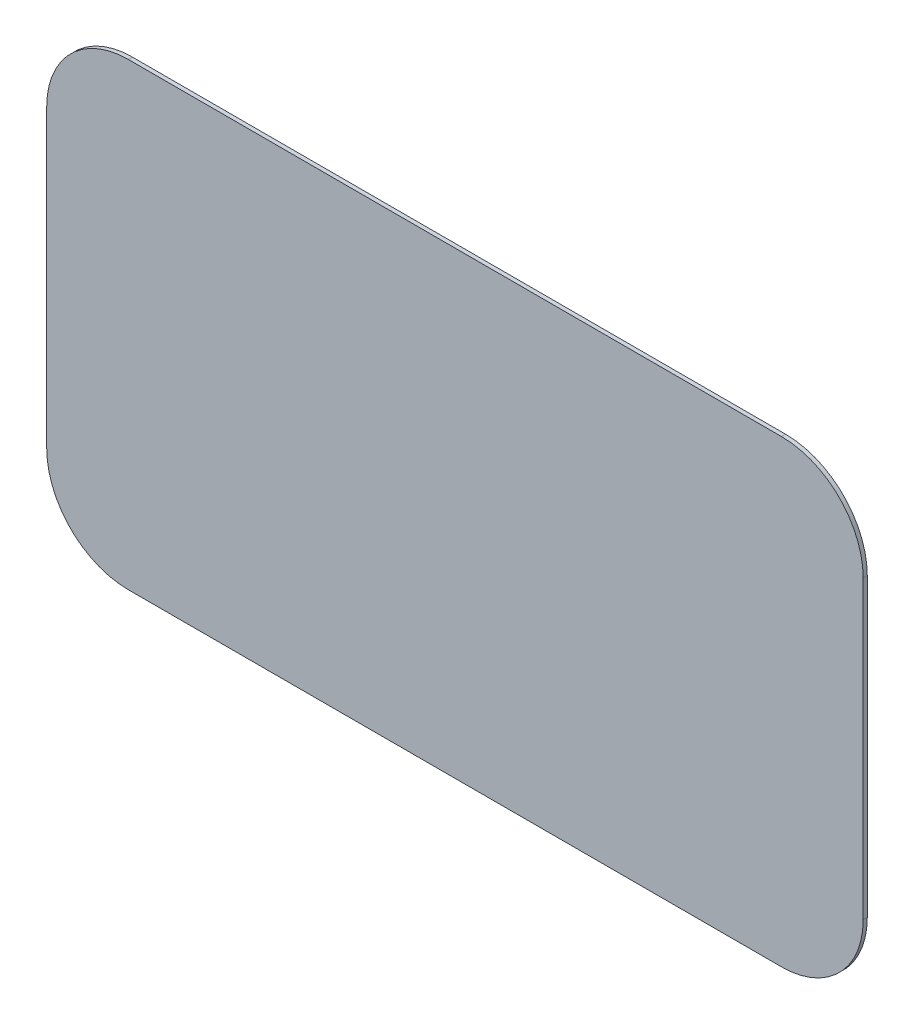
from build123d import *

# Parameters (mm, degrees)
SKETCH_1_W      = 20
SKETCH_1_H      = 11.25
EXTRUDE_1_DEPTH = 0.1
FILLET_1_R      = 2


with BuildPart() as part:
    # Эскиз1 → Бобышка-Вытянуть1 (new body)
    with BuildSketch(Plane.XY):
        Rectangle(SKETCH_1_W, SKETCH_1_H)
    extrude(amount=EXTRUDE_1_DEPTH)

    # Скругление1
    fillet_1_edges = [part.edges().sort_by_distance(p)[0] for p in [
        (-10, -5.625, 0.05),
        (-10, 5.625, 0.05),
        (10, -5.625, 0.05),
        (10, 5.625, 0.05),
    ]]
    fillet(fillet_1_edges, radius=FILLET_1_R)


solid = part.part
